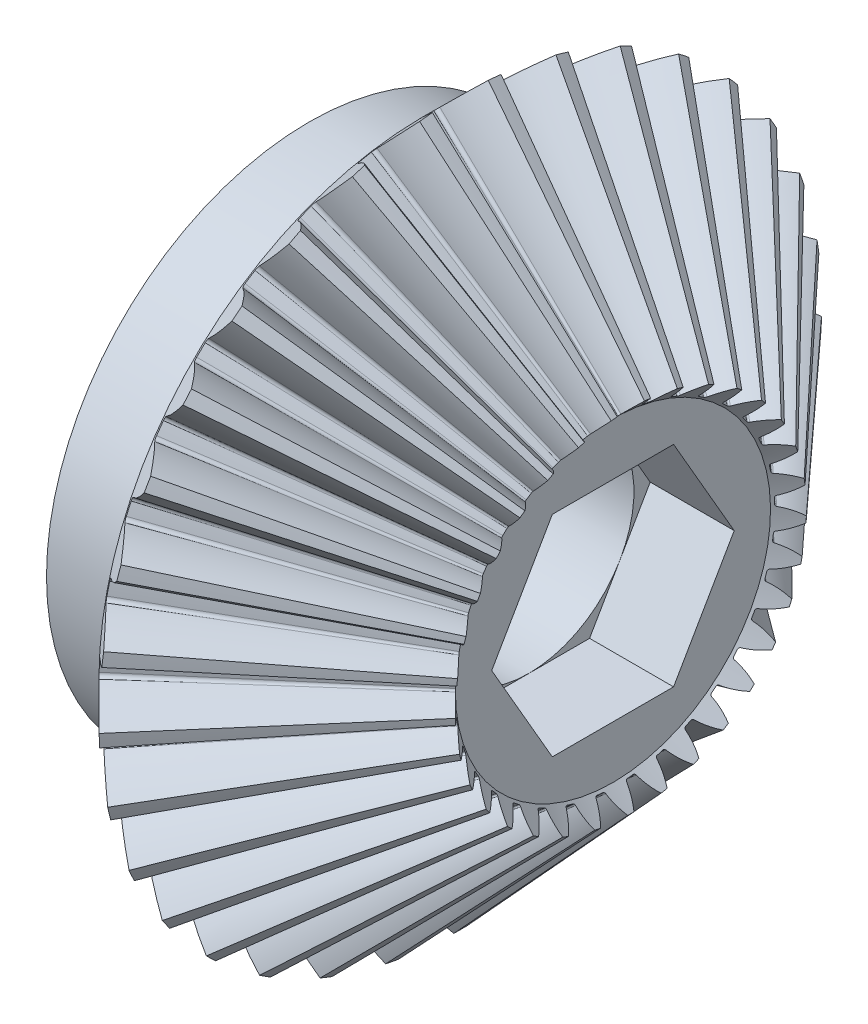
from build123d import *

# Parameters (mm, degrees)
TEETHCUTS_COUNT       = 33
TEETHCUTS_ANGLE       = 349.090909091
HUBSKE_R              = 12.5
HUB_DEPTH             = 5.449164146
BORSKE_R              = 2.5
BORE_DEPTH            = 23.0000508
CORTAR_EXTRUIR1_DEPTH = 4
CROQUIS3_R            = 5
CORTAR_EXTRUIR4_DEPTH = 24


with BuildPart() as part:
    # BasProSke → Base-Revolve (revolve)
    with BuildSketch(Plane(origin=(0, 0, 0), x_dir=(1, 0, 0), z_dir=(0, 1, 0)), mode=Mode.PRIVATE) as base_revolve_sk:
        Polygon((0, 0), (0, 15.449062547), (1.758044236, 17.207106781), (9.879689239, 8.358189035), (9.025735913, 7.504235711), (9.025735913, 0), align=None)
    revolve(base_revolve_sk.sketch.rotate(Axis((-10, 0, 0), (1, 0, 0)), 180), axis=Axis((-10, 0, 0), (1, 0, 0)))

    # ToothCut: read off the stored shape, not the designer's step
    # ToothCut: loft between two sections, ruled curve by curve
    toothcut_from = [
        Edge.make_bspline([(17.557371624, 0.006434169, -0.008859602), (17.552987386, 0.002049932, -0.015227606), (17.546735772, -0.004201682, -0.014317002), (17.543361398, -0.007576056, -0.006818885)], [0, 0, 0, 0, 1, 1, 1, 1], 3, [1, 0.74701913, 0.74701913, 1]),
        Edge.make_bspline([(17.543361398, -0.007576056, 0.006818885), (17.546735772, -0.004201682, 0.014317002), (17.552987386, 0.002049932, 0.015227606), (17.557371624, 0.006434169, 0.008859602)], [0, 0, 0, 0, 1, 1, 1, 1], 3, [1, 0.74701913, 0.74701913, 1]),
        Edge.make_bspline([(17.543361398, -0.007576056, -0.006818885), (17.542947276, -0.007990178, -0.005898674), (17.542619935, -0.008317519, -0.004911011), (17.542384772, -0.008552683, -0.003872176)], [0, 0, 0, 0, 1, 1, 1, 1], 3, [1, 0.994505488, 0.994505488, 1]),
        Edge.make_bspline([(17.542384772, -0.008552683, 0.003872176), (17.542619935, -0.008317519, 0.004911011), (17.542947276, -0.007990178, 0.005898674), (17.543361398, -0.007576056, 0.006818885)], [0, 0, 0, 0, 1, 1, 1, 1], 3, [1, 0.994505488, 0.994505488, 1]),
        Edge.make_bspline([(17.542384772, -0.008552683, -0.003872176), (17.541809982, -0.009127473, -0.00133304), (17.541809982, -0.009127473, 0.00133304), (17.542384772, -0.008552683, 0.003872176)], [0, 0, 0, 0, 1, 1, 1, 1], 3, [1, 0.968257159, 0.968257159, 1]),
        Edge.make_line((17.557371624, 0.006434169, 0.008859602), (17.557371624, 0.006434169, -0.008859602)),
    ]
    toothcut_to = [
        Edge.make_bspline([(1.957843945, 17.406906489, -1.550186802), (1.462436883, 16.911499428, -1.039232437), (0.9062007, 16.355263246, -0.674358083), (0.310395439, 15.759457986, -0.469509697)], [0, 0, 0, 0, 1, 1, 1, 1], 3, [1, 0.987259582, 0.987259582, 1]),
        Edge.make_bspline([(0.310395439, 15.759457986, 0.469509697), (0.9062007, 16.355263246, 0.674358083), (1.462436883, 16.911499428, 1.039232437), (1.957843945, 17.406906489, 1.550186802)], [0, 0, 0, 0, 1, 1, 1, 1], 3, [1, 0.987259582, 0.987259582, 1]),
        Edge.make_bspline([(0.310395439, 15.759457986, -0.469509697), (0.246991047, 15.696053594, -0.447710146), (0.207142743, 15.65620529, -0.374637034), (0.208346141, 15.657408688, -0.28237351)], [0, 0, 0, 0, 1, 1, 1, 1], 3, [1, 0.853648189, 0.853648189, 1]),
        Edge.make_bspline([(0.208346141, 15.657408688, 0.28237351), (0.207142743, 15.65620529, 0.374637034), (0.246991047, 15.696053594, 0.447710146), (0.310395439, 15.759457986, 0.469509697)], [0, 0, 0, 0, 1, 1, 1, 1], 3, [1, 0.853648189, 0.853648189, 1]),
        Edge.make_bspline([(0.208346141, 15.657408688, -0.28237351), (0.210801344, 15.659863891, -0.094135177), (0.210801344, 15.659863891, 0.094135177), (0.208346141, 15.657408688, 0.28237351)], [0, 0, 0, 0, 1, 1, 1, 1], 3, [1, 0.999886615, 0.999886615, 1]),
        Edge.make_line((1.957843945, 17.406906489, 1.550186802), (1.957843945, 17.406906489, -1.550186802)),
    ]
    toothcut = Solid(Shell([*[Face.make_surface_from_curves(toothcut_from[k], toothcut_to[k]) for k in range(6)], Face(Wire(toothcut_from)), Face(Wire(toothcut_to))]))
    add(toothcut, mode=Mode.SUBTRACT)

    # TeethCuts: ToothCut ×33 about axis
    teethcuts_axis = Axis((-10, 0, 0), (1, 0, 0))
    for i in range(1, TEETHCUTS_COUNT):
        add(toothcut.rotate(teethcuts_axis, i * TEETHCUTS_ANGLE / (TEETHCUTS_COUNT - 1)), mode=Mode.SUBTRACT)

    # HubSke → Hub (add)
    with BuildSketch(Plane.ZY):
        with Locations(Location((0, 0, 0), (0, 0, 180))):
            Circle(HUBSKE_R)
    extrude(amount=HUB_DEPTH)

    # BorSke → Bore (cut, symmetric)
    with BuildSketch(Plane(origin=(0, 0, 0), x_dir=(0, 0, -1), z_dir=(1, 0, 0))):
        with Locations(Location((0, 0, 0), (0, 0, 180))):
            Circle(BORSKE_R)
    extrude(amount=BORE_DEPTH, both=True, mode=Mode.SUBTRACT)

    # Croquis1 → Cortar-Extruir1 (cut)
    with BuildSketch(Plane(origin=(9.025735913, 0, 0), x_dir=(0, 0, -1), z_dir=(1, 0, 0))):
        Polygon((5.773502692, 0), (2.886751346, 5), (-2.886751346, 5), (-5.773502692, 0), (-2.886751346, -5), (2.886751346, -5), align=None)
    extrude(amount=-CORTAR_EXTRUIR1_DEPTH, mode=Mode.SUBTRACT)

    # Croquis3 → Cortar-Extruir4 (cut)
    with BuildSketch(Plane.ZY.offset(5.449164146)):
        Circle(CROQUIS3_R)
    extrude(amount=-CORTAR_EXTRUIR4_DEPTH, mode=Mode.SUBTRACT)


solid = part.part
